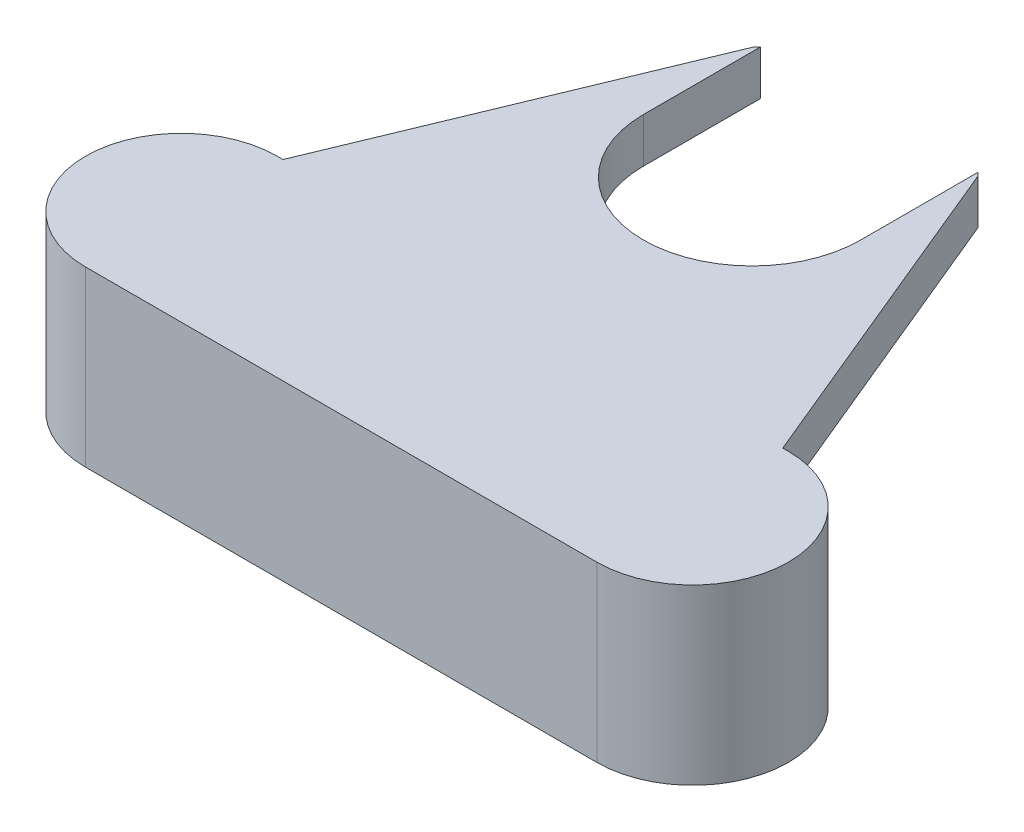
from build123d import *

# Parameters (mm, degrees)
BOSS_EXTRUDE1_DEPTH = 13.57
BOSS_EXTRUDE3_DEPTH = 3.5


with BuildPart() as part:
    # Sketch1 → Boss-Extrude1 (new body)
    with BuildSketch(Plane(origin=(0, 0, 0), x_dir=(1, 0, 0), z_dir=(0, 1, 0))):
        with BuildLine():
            Line((20, 7.5), (-20, 7.5))
            ThreePointArc((-20, 7.5), (-27.5, 0), (-20, -7.5))
            Line((-20, -7.5), (20, -7.5))
            ThreePointArc((20, -7.5), (27.5, 0), (20, 7.5))
        make_face()
    extrude(amount=BOSS_EXTRUDE1_DEPTH)

    # Sketch3 → Boss-Extrude3 (add)
    with BuildSketch(Plane(origin=(0, 13.57, 0), x_dir=(-1, 0, 0), z_dir=(0, -1, 0))):
        with BuildLine():
            Line((-19.549061387, 7.5), (19.549061387, 7.5))
            Line((19.549061387, 7.5), (8.749856339, 33.57158729))
            ThreePointArc((8.749856339, 33.57158729), (8.625750618, 33.691562414), (8.5, 33.809812331))
            Line((8.5, 33.809812331), (8.5, 24.644660941))
            ThreePointArc((8.5, 24.644660941), (0, 16.144660941), (-8.5, 24.644660941))
            Line((-8.5, 24.644660941), (-8.5, 33.809812331))
            ThreePointArc((-8.5, 33.809812331), (-8.625750618, 33.691562414), (-8.749856339, 33.57158729))
            Line((-8.749856339, 33.57158729), (-19.549061387, 7.5))
        make_face()
    extrude(amount=BOSS_EXTRUDE3_DEPTH)


solid = part.part
